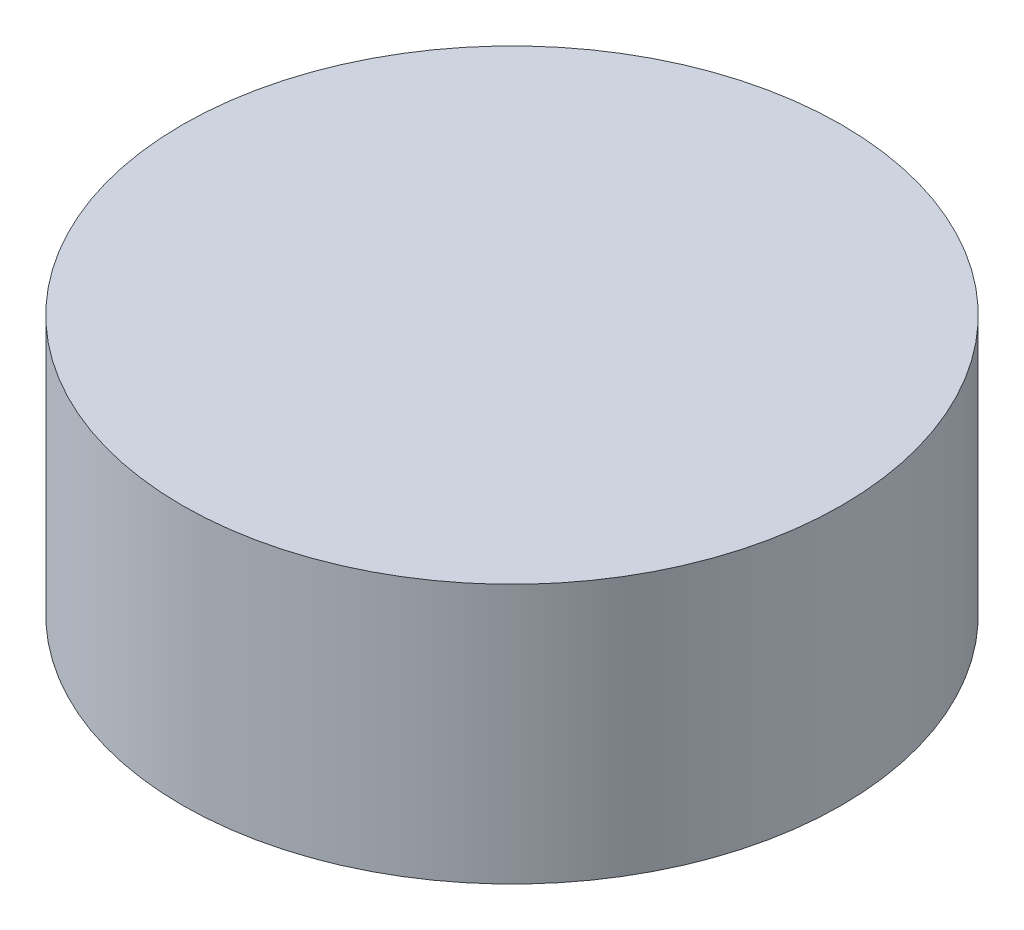
from build123d import *

# Parameters (mm, degrees)
SKETCH1_R           = 76.2
BOSS_EXTRUDE1_DEPTH = 60


with BuildPart() as part:
    # Sketch1 → Boss-Extrude1 (new body)
    with BuildSketch(Plane(origin=(0, 0, 0), x_dir=(1, 0, 0), z_dir=(0, 1, 0))):
        Circle(SKETCH1_R)
    extrude(amount=BOSS_EXTRUDE1_DEPTH)


solid = part.part
